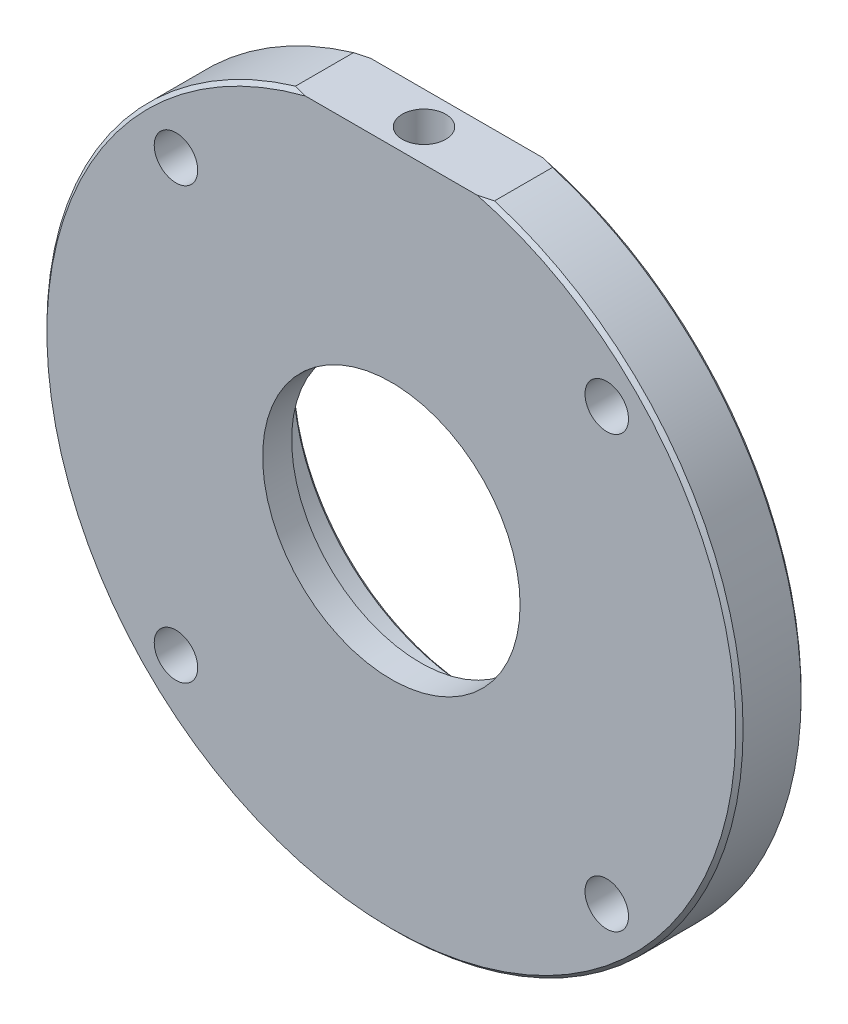
from build123d import *

# Parameters (mm, degrees)
SKETCH2_R                               = 3
CUT_EXTRUDE1_DEPTH                      = 69.476273263
F_3_0MM_DOWEL_HOLE1_D                   = 3
F_3_0MM_DOWEL_HOLE1_DEPTH               = 10.098709071
F_3_0MM_DOWEL_HOLE1_TIP                 = 0.901290929
CBORE_START                             = 39
CBORE_FOR_M6_HEX_HEAD_BOLT1_OUTLINE_R   = 3
CBORE_FOR_M6_HEX_HEAD_BOLT1_DEPTH       = 7
CBORE_START_2                           = 27.9999999
CBORE_FOR_M6_HEX_HEAD_BOLT1_2_OUTLINE_R = 1.5
CBORE_FOR_M6_HEX_HEAD_BOLT1_2_DEPTH     = 11.0000001
CHAMFER1_SIZE                           = 0.5


# Read off the part's stored shape, not the designer's step: CBORE for M6 Hex Head Bolt1
with BuildPart() as part:
    # Sketch1 → Revolve1 (revolve)
    with BuildSketch(Plane(origin=(0, 0, 0), x_dir=(0, 0, -1), z_dir=(1, 0, 0)), mode=Mode.PRIVATE) as revolve1_sk:
        Polygon((0, 17.75), (0, 48), (9, 48), (9, 36), (14, 36), (14, 30), (12, 30), (12, 25), (4, 25), (4, 17.75), align=None)
    revolve(revolve1_sk.sketch.rotate(Axis((0, 0, 0), (0, 0, -1)), 90), axis=Axis((0, 0, 0), (0, 0, -1)))

    # Sketch2 → Cut-Extrude1 (cut, through all)
    with BuildSketch(Plane(origin=(0, 0, -9), x_dir=(-1, 0, 0), z_dir=(0, 0, -1))):
        with Locations((29.69848481, 29.69848481)):
            Circle(SKETCH2_R)
        with Locations((29.69848481, -29.69848481)):
            Circle(SKETCH2_R)
        with Locations((-29.69848481, -29.69848481)):
            Circle(SKETCH2_R)
        with Locations((-29.69848481, 29.69848481)):
            Circle(SKETCH2_R)
        with BuildLine():
            Line((-13.711309201, 46), (13.711309201, 46))
            ThreePointArc((13.711309201, 46), (0, 48), (-13.711309201, 46))
        make_face()
    extrude(amount=-CUT_EXTRUDE1_DEPTH, mode=Mode.SUBTRACT)

    # Ø3.0mm Dowel Hole1
    with Locations(Plane(origin=(0, 0, -12), x_dir=(-1, 0, 0), z_dir=(0, 0, -1))):
        with Locations((0, 28)):
            Hole(F_3_0MM_DOWEL_HOLE1_D / 2, depth=F_3_0MM_DOWEL_HOLE1_DEPTH)
            with Locations((0, 0, -(F_3_0MM_DOWEL_HOLE1_DEPTH + F_3_0MM_DOWEL_HOLE1_TIP / 2))):  # 118° drill point
                Cone(0, F_3_0MM_DOWEL_HOLE1_D / 2, F_3_0MM_DOWEL_HOLE1_TIP, mode=Mode.SUBTRACT)

    # CBORE for M6 Hex Head Bolt1 outline → CBORE for M6 Hex Head Bolt1 (cut)
    with BuildSketch(Plane(origin=(0, 0, 0), x_dir=(1, 0, 0), z_dir=(0, 1, 0)).offset(CBORE_START)):
        with Locations((0, 4.5)):
            Circle(CBORE_FOR_M6_HEX_HEAD_BOLT1_OUTLINE_R)
    extrude(amount=CBORE_FOR_M6_HEX_HEAD_BOLT1_DEPTH, mode=Mode.SUBTRACT)

    # CBORE for M6 Hex Head Bolt1 2 outline → CBORE for M6 Hex Head Bolt1 2 (cut)
    with BuildSketch(Plane(origin=(0, 0, 0), x_dir=(1, 0, 0), z_dir=(0, 1, 0)).offset(CBORE_START_2)):
        with Locations((0, 4.5)):
            Circle(CBORE_FOR_M6_HEX_HEAD_BOLT1_2_OUTLINE_R)
    extrude(amount=CBORE_FOR_M6_HEX_HEAD_BOLT1_2_DEPTH, mode=Mode.SUBTRACT)

    # Chamfer1
    chamfer1_edges = [part.edges().sort_by_distance(p)[0] for p in [
        (-36, 0, -14),
        (0, -48, -9),
        (0, -48, 0),
        (-25, 0, -12),
    ]]
    chamfer(chamfer1_edges, length=CHAMFER1_SIZE)


solid = part.part
